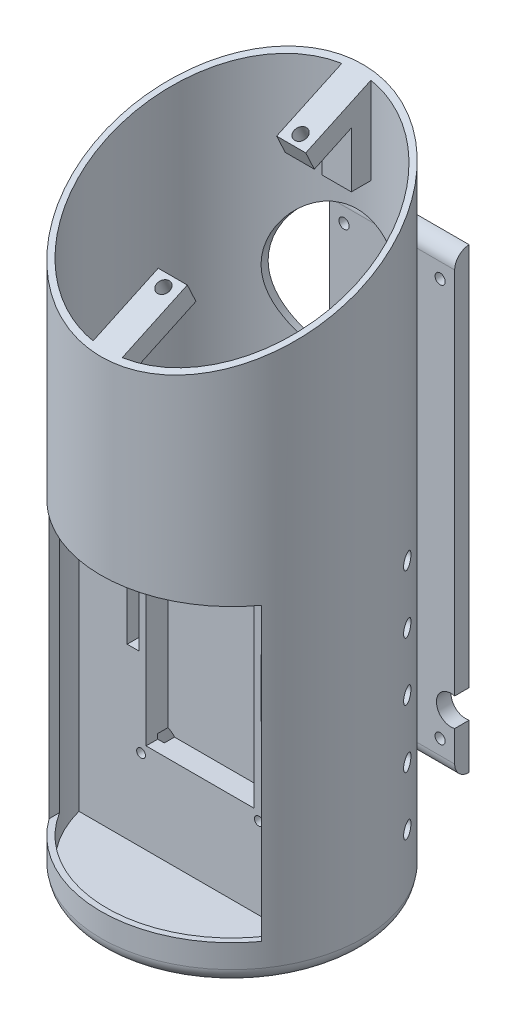
from build123d import *

# Parameters (mm, degrees)
SKETCH1_R                = 45
SKETCH1_R_2              = 43
BOSS_EXTRUDE1_DEPTH      = 215
CUT_EXTRUDE1_DEPTH       = 123.00000000000001
CUT_EXTRUDE1_DEPTH_BACK  = 120.00000000000003
SKETCH4_R                = 44.87215452957415
BOSS_EXTRUDE2_DEPTH      = 5
SKETCH5_RX               = 49.65200635331226
SKETCH5_RY               = 45
SKETCH5_R                = 10.000000000000016
BOSS_EXTRUDE3_DEPTH      = 5
BOSS_EXTRUDE4_DEPTH      = 6
BOSS_EXTRUDE4_DEPTH_BACK = 6
SKETCH8_R                = 1.7500000000000004
BOSS_EXTRUDE5_DEPTH      = 5
BOSS_EXTRUDE6_DEPTH      = 5
BOSS_EXTRUDE6_DEPTH_BACK = 5
CUT_EXTRUDE2_DEPTH       = 81.99999999999999
BOSS_EXTRUDE8_DEPTH      = 41.99999999999996
BOSS_EXTRUDE8_DEPTH_BACK = 41.99999999999996
CUT_EXTRUDE3_REACH       = 237.075
SKETCH13_R               = 1.5000000000000009
SKETCH14_R               = 2.1999999999999877
SKETCH14_R_2             = 2.199999999999998
CUT_EXTRUDE4_DEPTH       = 12
CUT_EXTRUDE6_DEPTH       = 7.5
CUT_EXTRUDE7_DEPTH       = 5
CUT_EXTRUDE7_DEPTH_BACK  = 70
CUT_EXTRUDE7_START       = -9
SKETCH17_R               = 5.000000000000002
SKETCH17_R_2             = 5.000000000000001
SKETCH19_W               = 60.00000000000001
SKETCH19_H               = 5
CUT_EXTRUDE8_DEPTH       = 5
FILLET1_R                = 5
CUT_EXTRUDE9_START       = -40
SKETCH20_R               = 5.000000000000001
CUT_EXTRUDE9_DEPTH       = 10
CUT_EXTRUDE10_DEPTH      = 100
CUT_EXTRUDE10_DEPTH_BACK = 100
SKETCH21_R               = 2.499999999999999
SKETCH21_R_2             = 2.5000000000000027
SKETCH21_R_3             = 2.4999999999999982
CUT_EXTRUDE11_DEPTH      = 20
CUT_EXTRUDE11_DEPTH_BACK = 20
SKETCH15_R               = 50
CUT_EXTRUDE5_DEPTH       = 5
SKETCH24_R               = 25
CUT_EXTRUDE13_DEPTH      = 48.999999999999986


with BuildPart() as part:
    # Sketch1 → Boss-Extrude1 (new body)
    with BuildSketch(Plane(origin=(0, 0, 0), x_dir=(1, 0, 0), z_dir=(0, 1, 0))):
        with Locations(Location((0, 0, 0), (0, 0, 270))):
            Circle(SKETCH1_R)
        with Locations(Location((0, 0, 0), (0, 0, 270))):
            Circle(SKETCH1_R_2, mode=Mode.SUBTRACT)
    extrude(amount=BOSS_EXTRUDE1_DEPTH)

    # Sketch3 → Cut-Extrude1 (cut, two sides: drawn at the far end of the back side and taken through both)
    with BuildSketch(Plane(origin=(0, 0, 0), x_dir=(0, 0, -1), z_dir=(1, 0, 0)).offset(-CUT_EXTRUDE1_DEPTH_BACK)):
        Polygon((-45.00000000000001, 215), (45.00000000000001, 215), (-45.00000000000001, 173.0323107660496), align=None)
    extrude(amount=CUT_EXTRUDE1_DEPTH + CUT_EXTRUDE1_DEPTH_BACK, mode=Mode.SUBTRACT)

    # Sketch4 → Boss-Extrude2 (add)
    with BuildSketch(Plane.XZ):
        with Locations(Location((0, 0, 0), (0, 0, 270))):
            Circle(SKETCH4_R)
    extrude(amount=BOSS_EXTRUDE2_DEPTH)

    # Sketch5 → Boss-Extrude3 (add)
    with BuildSketch(Plane(origin=(0, 159.36366807112498, 74.31249885323777), x_dir=(1, 0, 0), z_dir=(0, 0.9063077870366478, 0.42261826174070405))):
        with Locations(Location((0, 81.99477033758825), (0, 0, 90))):
            Ellipse(SKETCH5_RX, SKETCH5_RY)
        with Locations(Location((0, 81.99477033758825, 0), (0, 0, 270))):
            Circle(SKETCH5_R, mode=Mode.SUBTRACT)
    extrude(amount=BOSS_EXTRUDE3_DEPTH)

    # Sketch7 → Boss-Extrude4 (add, two sides: drawn at the far end of the back side and taken through both)
    with BuildSketch(Plane(origin=(0, 0, 0), x_dir=(0, 0, -1), z_dir=(1, 0, 0)).offset(-BOSS_EXTRUDE4_DEPTH_BACK)):
        Polygon((45.00000000000001, 120), (55.00000000000001, 120), (55.000000000000036, 40), (45.00000000000001, 39.99999999999999), (40.00000000000001, 39.99999999999999), (40, 120), align=None)
    extrude(amount=BOSS_EXTRUDE4_DEPTH + BOSS_EXTRUDE4_DEPTH_BACK)

    # Sketch8 → Boss-Extrude5 (add)
    with BuildSketch(Plane(origin=(0, 1.908e-14, -55.00000000000005), x_dir=(-1, 0, 0), z_dir=(0, 0, -1))):
        Polygon((21.499999999999964, 164.59447480438874), (-21.50000000000003, 164.5944748043887), (-21.499999999999986, 7.59447480438873), (21.50000000000001, 7.594474804388735), align=None)
        with Locations((16.49999999999998, 154.45947480438875)):
            Circle(SKETCH8_R, mode=Mode.SUBTRACT)
        with Locations((-16.50000000000002, 154.45947480438875)):
            Circle(SKETCH8_R, mode=Mode.SUBTRACT)
        with Locations((16.500000000000025, 17.729474804388744)):
            Circle(SKETCH8_R, mode=Mode.SUBTRACT)
        with Locations((-16.499999999999975, 17.729474804388737)):
            Circle(SKETCH8_R, mode=Mode.SUBTRACT)
    extrude(amount=BOSS_EXTRUDE5_DEPTH)

    # Sketch9 → Boss-Extrude6 (add, two sides: drawn at the far end of the back side and taken through both)
    with BuildSketch(Plane(origin=(0, 0, 0), x_dir=(0, 0, -1), z_dir=(1, 0, 0)).offset(-BOSS_EXTRUDE6_DEPTH_BACK)):
        Polygon((43, 184.06738468368994), (43, 214.06738468368997), (20.34230532408381, 203.50192814017234), (23.30063315626873, 197.1577736309158), (36, 203.07958564386743), (36.00000000000001, 184.06738468368994), align=None)
        Polygon((-43, 143.96492608235957), (-43, 173.96492608235957), (-20.3423053240838, 184.53038262587714), (-17.38397749189887, 178.1862281166206), (-36.00000000000001, 169.5054342567071), (-36.00000000000001, 143.96492608235963), align=None)
    extrude(amount=BOSS_EXTRUDE6_DEPTH + BOSS_EXTRUDE6_DEPTH_BACK)

    # Sketch2 → Cut-Extrude2 (cut)
    with BuildSketch(Plane.XY):
        Polygon((-36.50000000000003, 108.00000000000001), (36.49999999999997, 108.00000000000001), (36.5, 8), (-36.5, 8), align=None)
    extrude(amount=CUT_EXTRUDE2_DEPTH, mode=Mode.SUBTRACT)

    # Sketch12 → Boss-Extrude8 (add, two sides: drawn at the far end of the back side and taken through both)
    with BuildSketch(Plane(origin=(0, 0, 0), x_dir=(0, 0, -1), z_dir=(1, 0, 0)).offset(-BOSS_EXTRUDE8_DEPTH_BACK)):
        Polygon((-11.000000000000002, 109), (-2.0000000000000018, 109), (-1.999999999999988, 0), (-10.999999999999988, 0), align=None)
    extrude(amount=BOSS_EXTRUDE8_DEPTH + BOSS_EXTRUDE8_DEPTH_BACK)

    # Sketch13 → Cut-Extrude3 (cut, up to next)
    with BuildSketch(Plane.XY.offset(10.999999999999988), mode=Mode.PRIVATE) as cut_extrude3_sk1:
        with Locations((-28.170000000000005, 98.13)):
            Circle(SKETCH13_R)
    cut_extrude3_tool1 = extrude(cut_extrude3_sk1.sketch, amount=-CUT_EXTRUDE3_REACH, mode=Mode.PRIVATE) & part.part
    # Sketch13 → Cut-Extrude3 (cut, up to next)
    with BuildSketch(Plane.XY.offset(10.999999999999988), mode=Mode.PRIVATE) as cut_extrude3_sk2:
        with Locations((-20.240000000000006, 28.000000000000004)):
            Circle(SKETCH13_R)
    cut_extrude3_tool2 = extrude(cut_extrude3_sk2.sketch, amount=-CUT_EXTRUDE3_REACH, mode=Mode.PRIVATE) & part.part
    # Sketch13 → Cut-Extrude3 (cut, up to next)
    with BuildSketch(Plane.XY.offset(10.999999999999988), mode=Mode.PRIVATE) as cut_extrude3_sk3:
        with Locations(Location((20.240000000000006, 28.000000000000004, 0), (0, 0, 90))):
            Circle(SKETCH13_R)
    cut_extrude3_tool3 = extrude(cut_extrude3_sk3.sketch, amount=-CUT_EXTRUDE3_REACH, mode=Mode.PRIVATE) & part.part
    # Sketch13 → Cut-Extrude3 (cut, up to next)
    with BuildSketch(Plane.XY.offset(10.999999999999988), mode=Mode.PRIVATE) as cut_extrude3_sk4:
        with Locations(Location((28.170000000000005, 98.13, 0), (0, 0, 90))):
            Circle(SKETCH13_R)
    cut_extrude3_tool4 = extrude(cut_extrude3_sk4.sketch, amount=-CUT_EXTRUDE3_REACH, mode=Mode.PRIVATE) & part.part
    add(cut_extrude3_tool1.solids().sort_by_distance((-28.17, 98.13, 11))[0], mode=Mode.SUBTRACT)
    add(cut_extrude3_tool2.solids().sort_by_distance((-20.24, 28, 11))[0], mode=Mode.SUBTRACT)
    add(cut_extrude3_tool3.solids().sort_by_distance((20.24, 28, 11))[0], mode=Mode.SUBTRACT)
    add(cut_extrude3_tool4.solids().sort_by_distance((28.17, 98.13, 11))[0], mode=Mode.SUBTRACT)

    # Sketch14 → Cut-Extrude4 (cut)
    with BuildSketch(Plane(origin=(0, 163.89520700630823, 76.42559016194132), x_dir=(1, 0, 0), z_dir=(0, 0.9063077870366478, 0.42261826174070405))):
        with Locations(Location((-1.1102e-13, 107.99477033758825, 0), (0, 0, 270))):
            Circle(SKETCH14_R)
        with Locations(Location((-1.1102e-13, 55.994770337588264, 0), (0, 0, 90))):
            Circle(SKETCH14_R_2)
    extrude(amount=-CUT_EXTRUDE4_DEPTH, mode=Mode.SUBTRACT)

    # Sketch16 → Cut-Extrude6 (cut)
    with BuildSketch(Plane.XY.offset(10.999999999999988)):
        Polygon((18.49999999999998, 31.000000000000007), (-18.50000000000002, 31), (-18.500000000000025, 109.00000000000001), (18.499999999999982, 109.00000000000001), align=None)
    extrude(amount=-CUT_EXTRUDE6_DEPTH, mode=Mode.SUBTRACT)

    # Sketch17 → Cut-Extrude7 (cut, two sides: drawn at the far end of the back side and taken through both)
    with BuildSketch(Plane.XY.offset(10.999999999999988).offset(CUT_EXTRUDE7_START - CUT_EXTRUDE7_DEPTH_BACK)):
        with Locations((-28.170000000000005, 98.13)):
            Circle(SKETCH17_R)
        with Locations(Location((-20.240000000000006, 28.000000000000004, 0), (0, 0, 36.869897646))):
            Circle(SKETCH17_R_2)
        with Locations(Location((20.23999999999999, 28.000000000000004, 0), (0, 0, 90))):
            Circle(SKETCH17_R_2)
        with Locations(Location((28.169999999999956, 98.13000000000001, 0), (0, 0, 90))):
            Circle(SKETCH17_R)
    extrude(amount=CUT_EXTRUDE7_DEPTH + CUT_EXTRUDE7_DEPTH_BACK, mode=Mode.SUBTRACT)

    # Sketch19 → Cut-Extrude8 (cut)
    with BuildSketch(Plane.XZ.offset(5)):
        Rectangle(SKETCH19_W, SKETCH19_H)
    extrude(amount=-CUT_EXTRUDE8_DEPTH, mode=Mode.SUBTRACT)

    # Fillet1
    fillet1_edges = [part.edges().sort_by_distance(p)[0] for p in [
        (-1.654e-14, 177.56384970123278, 47.11309130870352),
        (-6, 40, -49.799103120977776),
        (6, 40, -49.799103120977776),
        (-6, 120, -49.79910312097776),
        (6, 120, -49.79910312097776),
        (1.374e-14, -5, 44.87215452957415),
        (0, -5, 2.5),
        (0, -5, -2.5),
        (-1.421e-14, 7.594474804388751, -55.00000000000005),
        (3.197e-14, 164.59447480438874, -55.00000000000005),
    ]]
    fillet(fillet1_edges, radius=FILLET1_R - 0.0001)  # a hair under: the kernel refuses the full size

    # Sketch20 → Cut-Extrude9 (cut)
    with BuildSketch(Plane.XY.offset(CUT_EXTRUDE9_START)):
        with Locations(Location((0, 25.255094523387275, 0), (0, 0, 90))):
            Circle(SKETCH20_R)
    extrude(amount=-CUT_EXTRUDE9_DEPTH, mode=Mode.SUBTRACT)

    # Sketch21 → Cut-Extrude10 (cut, two sides: drawn at the far end of the back side and taken through both)
    with BuildSketch(Plane(origin=(0, 0, 0), x_dir=(0, 0, -1), z_dir=(1, 0, 0)).offset(-CUT_EXTRUDE10_DEPTH_BACK)):
        with Locations(Location((20.00000000000012, 60, 0), (0, 0, 180))):
            Circle(SKETCH21_R)
        with Locations(Location((20.00000000000012, 100, 0), (0, 0, 180))):
            Circle(SKETCH21_R_2)
        with Locations(Location((20.00000000000012, 20, 0), (0, 0, 180))):
            Circle(SKETCH21_R_3)
        with Locations(Location((20.00000000000012, 40, 0), (0, 0, 180))):
            Circle(SKETCH21_R)
        with Locations(Location((20.00000000000012, 80, 0), (0, 0, 180))):
            Circle(SKETCH21_R)
    extrude(amount=CUT_EXTRUDE10_DEPTH + CUT_EXTRUDE10_DEPTH_BACK, mode=Mode.SUBTRACT)

    # Sketch22 → Cut-Extrude11 (cut, two sides: drawn at the far end of the back side and taken through both)
    with BuildSketch(Plane.XY.offset(3.4999999999999876).offset(-CUT_EXTRUDE11_DEPTH_BACK)):
        Polygon((24.999999999999996, 58.00000000000001), (20.999999999999996, 58.00000000000001), (21, 78.00000000000001), (25, 78.00000000000001), align=None)
        Polygon((-25, 78.00000000000001), (-21, 78.00000000000001), (-20.999999999999996, 58.00000000000001), (-24.999999999999996, 58.00000000000001), align=None)
    extrude(amount=CUT_EXTRUDE11_DEPTH + CUT_EXTRUDE11_DEPTH_BACK, mode=Mode.SUBTRACT)

    # Sketch15 → Cut-Extrude5 (cut)
    with BuildSketch(Plane(origin=(0, 163.89520700630823, 76.42559016194132), x_dir=(1, 0, 0), z_dir=(0, 0.9063077870366478, 0.42261826174070405))):
        with Locations((0, 81.99477033758826)):
            Circle(SKETCH15_R)
    extrude(amount=-CUT_EXTRUDE5_DEPTH, mode=Mode.SUBTRACT)

    # Sketch24 → Cut-Extrude13 (cut)
    with BuildSketch(Plane.XY):
        with Locations(Location((0, 148, 0), (0, 0, 90))):
            Circle(SKETCH24_R)
    extrude(amount=-CUT_EXTRUDE13_DEPTH, mode=Mode.SUBTRACT)


solid = part.part
